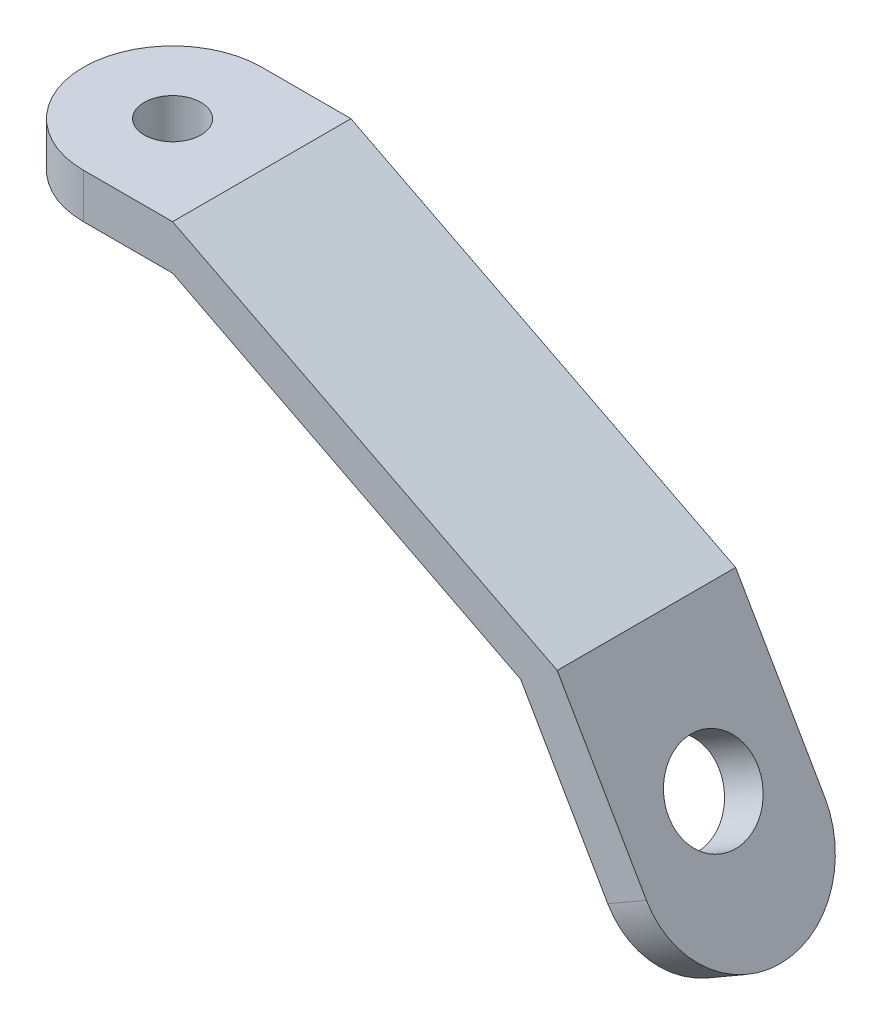
from build123d import *

# Parameters (mm, degrees)
BOSS_EXTRUDE1_DEPTH = 10
SKETCH2_R           = 3.175
CUT_EXTRUDE1_DEPTH  = 86.380649173
SKETCH3_R           = 5
CUT_EXTRUDE2_DEPTH  = 80.450837411
FILLET1_R           = 10


with BuildPart() as part:
    # Sketch1 → Boss-Extrude1 (new, symmetric)
    with BuildSketch(Plane.XY):
        Polygon((-10, 70), (10, 70), (53.121778265, 47.990381057), (68.121778265, 22.009618943), (63.791651246, 19.509618943), (49.028935235, 45.079393131), (10, 65), (-10, 65), align=None)
    extrude(amount=BOSS_EXTRUDE1_DEPTH, both=True)

    # Sketch2 → Cut-Extrude1 (cut, through all)
    with BuildSketch(Plane(origin=(0, 70, 0), x_dir=(1, 0, 0), z_dir=(0, 1, 0))):
        with Locations(Location((0, 0, 0), (0, 0, 270))):
            Circle(SKETCH2_R)
    extrude(amount=-CUT_EXTRUDE1_DEPTH, mode=Mode.SUBTRACT)

    # Sketch3 → Cut-Extrude2 (cut, through all)
    with BuildSketch(Plane(origin=(60.621778265, 35, 0), x_dir=(0, 0, -1), z_dir=(0.8660254037844397, 0.499999999999998, 0))):
        with Locations(Location((0, 0, 0), (0, 0, 90))):
            Circle(SKETCH3_R)
    extrude(amount=-CUT_EXTRUDE2_DEPTH, mode=Mode.SUBTRACT)

    # Fillet1
    fillet1_edges = [part.edges().sort_by_distance(p)[0] for p in [
        (65.956714755, 20.759618943, -10),
        (65.956714755, 20.759618943, 10),
        (-10, 67.5, -10),
        (-10, 67.5, 10),
    ]]
    fillet(fillet1_edges, radius=FILLET1_R - 0.0001)  # a hair under: the kernel refuses the full size


solid = part.part
